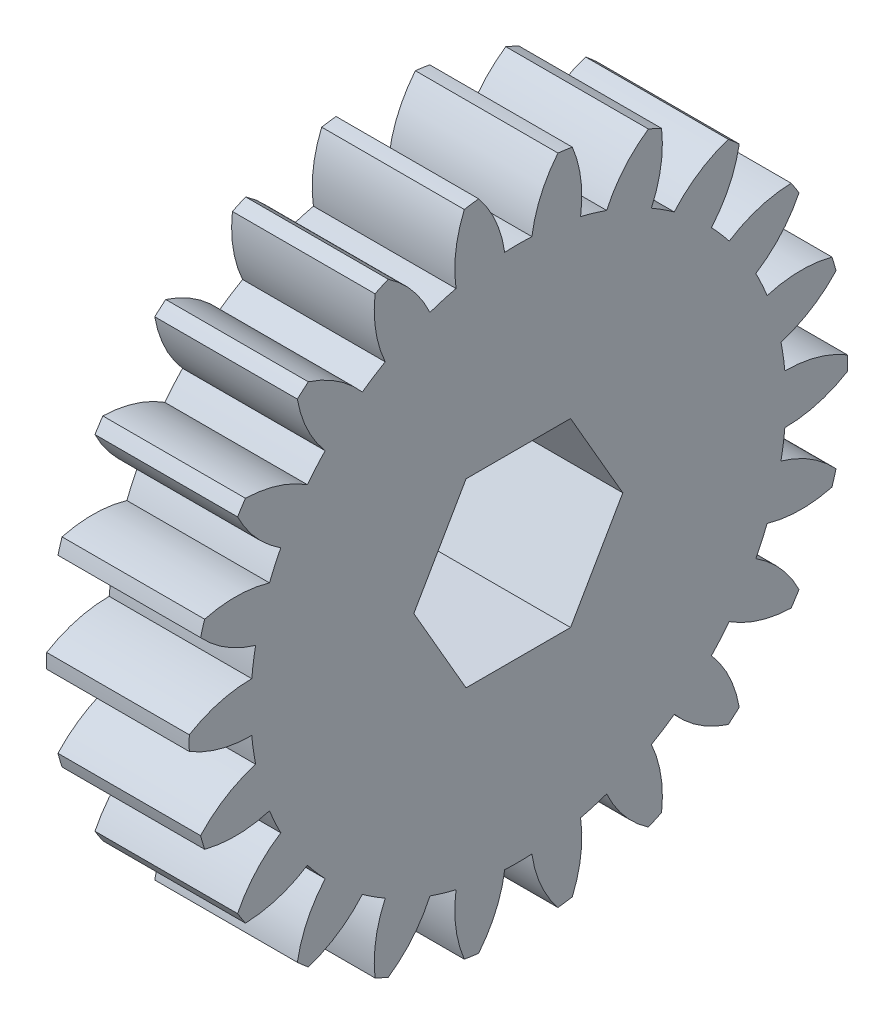
from build123d import *

# Parameters (mm, degrees)
BASPROSKE_W         = 6.604
BASPROSKE_H         = 15.24
TOOTHCUT_DEPTH      = 23.541695056
TEETHCUTS_COUNT     = 22
TEETHCUTS_ANGLE     = 343.636363636
BORSKE_R            = 0.499999
BORE_DEPTH          = 50.8000508
SKETCH1_R           = 6.985
BOSS_EXTRUDE1_DEPTH = 2.286
CUT_EXTRUDE1_DEPTH  = 24.241702632
CHAMFER1_SIZE       = 0.254


with BuildPart() as part:
    # BasProSke → Base-Revolve (revolve)
    with BuildSketch(Plane(origin=(0, 0, 0), x_dir=(1, 0, 0), z_dir=(0, 1, 0))):
        with Locations((3.302, 7.62)):
            Rectangle(BASPROSKE_W, BASPROSKE_H)
    revolve(axis=Axis((-10, 0, 0), (1, 0, 0)))

    # TooCutSke → ToothCut (cut, through all)
    with BuildSketch(Plane(origin=(0, 0, 0), x_dir=(0, 0, -1), z_dir=(1, 0, 0))):
        with BuildLine():
            ThreePointArc((0.629474743, 12.379206137), (0, 12.3952), (-0.629474743, 12.379206137))
            ThreePointArc((-0.629474743, 12.379206137), (-1.05059125, 13.850443254), (-1.855031489, 15.152270303))
            ThreePointArc((-1.855031489, 15.152270303), (0, 15.2654), (1.855031489, 15.152270303))
            ThreePointArc((1.855031489, 15.152270303), (1.05059125, 13.850443254), (0.629474743, 12.379206137))
        make_face()
    toothcut = extrude(amount=TOOTHCUT_DEPTH, mode=Mode.SUBTRACT)

    # TeethCuts: ToothCut ×22 about axis
    teethcuts_axis = Axis((-10, 0, 0), (1, 0, 0))
    for i in range(1, TEETHCUTS_COUNT):
        add(toothcut.rotate(teethcuts_axis, i * TEETHCUTS_ANGLE / (TEETHCUTS_COUNT - 1)), mode=Mode.SUBTRACT)

    # BorSke → Bore (cut, symmetric)
    with BuildSketch(Plane(origin=(0, 0, 0), x_dir=(0, 0, -1), z_dir=(1, 0, 0))):
        Circle(BORSKE_R)
    extrude(amount=BORE_DEPTH, both=True, mode=Mode.SUBTRACT)

    # Sketch1 → Boss-Extrude1 (add)
    with BuildSketch(Plane.ZY):
        Circle(SKETCH1_R)
    extrude(amount=BOSS_EXTRUDE1_DEPTH)

    # Sketch2 → Cut-Extrude1 (cut, through all)
    with BuildSketch(Plane(origin=(6.604, 0, 0), x_dir=(0, 0, -1), z_dir=(1, 0, 0))):
        Polygon((2.419674978, 4.191), (-2.419674978, 4.191), (-4.839349956, 0), (-2.419674978, -4.191), (2.419674978, -4.191), (4.839349956, 0), align=None)
    extrude(amount=-CUT_EXTRUDE1_DEPTH, mode=Mode.SUBTRACT)

    # Chamfer1
    chamfer1_edges = [part.edges().sort_by_distance(p)[0] for p in [
        (-2.286, 0, -6.985),
    ]]
    chamfer(chamfer1_edges, length=CHAMFER1_SIZE)


solid = part.part
